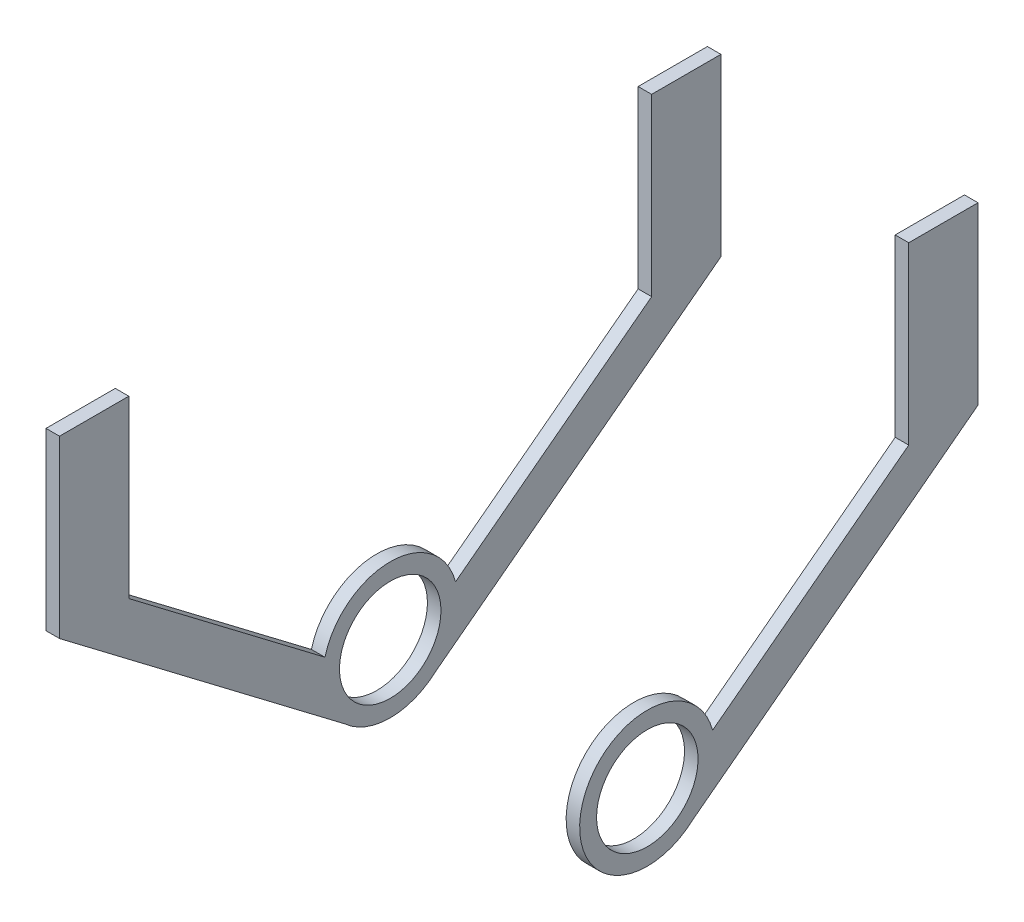
from build123d import *

# Parameters (mm, degrees)
SKETCH1_R           = 50
SKETCH1_R_2         = 37.5
BOSS_EXTRUDE1_DEPTH = 10
BOSS_EXTRUDE2_DEPTH = 10
SKETCH3_W           = 51.205139086
SKETCH3_H           = 129.53767852
BOSS_EXTRUDE3_DEPTH = 10
SKETCH5_R           = 50
SKETCH5_R_2         = 37.5
BOSS_EXTRUDE4_DEPTH = 10
BOSS_EXTRUDE5_START = 10
BOSS_EXTRUDE5_DEPTH = 10
SKETCH8_W           = 51.205139086
SKETCH8_H           = 129.53767852
BOSS_EXTRUDE6_DEPTH = 10


with BuildPart() as part:
    # Sketch1 → Boss-Extrude1 (new body)
    with BuildSketch(Plane(origin=(0, 0, 0), x_dir=(0, 0, -1), z_dir=(1, 0, 0))):
        Circle(SKETCH1_R)
        Circle(SKETCH1_R_2, mode=Mode.SUBTRACT)
    extrude(amount=BOSS_EXTRUDE1_DEPTH)

    # Sketch2 → Boss-Extrude2 (add)
    with BuildSketch(Plane(origin=(0, 0, 0), x_dir=(0, 0, -1), z_dir=(1, 0, 0))):
        with BuildLine():
            Line((-48.284064966, 12.986495694), (-193.217699207, 122.995180065))
            Line((-193.217699207, 122.995180065), (-244.422838293, 122.995180065))
            Line((-244.422838293, 122.995180065), (-33.61548005, -37.013504306))
            ThreePointArc((-33.61548005, -37.013504306), (-47.977951899, -14.07537323), (-48.284064966, 12.986495694))
        make_face()
    boss_extrude2 = extrude(amount=BOSS_EXTRUDE2_DEPTH)

    # Sketch3 → Boss-Extrude3 (add)
    with BuildSketch(Plane(origin=(0, 0, 0), x_dir=(0, 0, -1), z_dir=(1, 0, 0))):
        with Locations((-218.82026875, 187.764019325)):
            Rectangle(SKETCH3_W, SKETCH3_H)
    boss_extrude3 = extrude(amount=BOSS_EXTRUDE3_DEPTH)

    # Mirror2: Boss-Extrude2, Boss-Extrude3 across plane
    add(boss_extrude2.mirror(Plane.XY))
    add(boss_extrude3.mirror(Plane.XY))


with BuildPart() as body_2:
    # Sketch5 → Boss-Extrude4 (new body)
    with BuildSketch(Plane.ZY.offset(-200)):
        Circle(SKETCH5_R)
        Circle(SKETCH5_R_2, mode=Mode.SUBTRACT)
    extrude(amount=BOSS_EXTRUDE4_DEPTH)

    # Sketch7 → Boss-Extrude5 (add)
    with BuildSketch(Plane.ZY.offset(-200).offset(BOSS_EXTRUDE5_START)):
        with BuildLine():
            Line((-48.284064966, 12.986495694), (-193.217699207, 122.995180065))
            Line((-193.217699207, 122.995180065), (-244.422838293, 122.995180065))
            Line((-244.422838293, 122.995180065), (-33.61548005, -37.013504306))
            ThreePointArc((-33.61548005, -37.013504306), (-47.977951899, -14.07537323), (-48.284064966, 12.986495694))
        make_face()
    extrude(amount=-BOSS_EXTRUDE5_DEPTH)

    # Sketch8 → Boss-Extrude6 (add)
    with BuildSketch(Plane.ZY.offset(-200)):
        with Locations((-218.82026875, 187.764019325)):
            Rectangle(SKETCH8_W, SKETCH8_H)
    extrude(amount=BOSS_EXTRUDE6_DEPTH)


solid = Compound([part.part, body_2.part])
